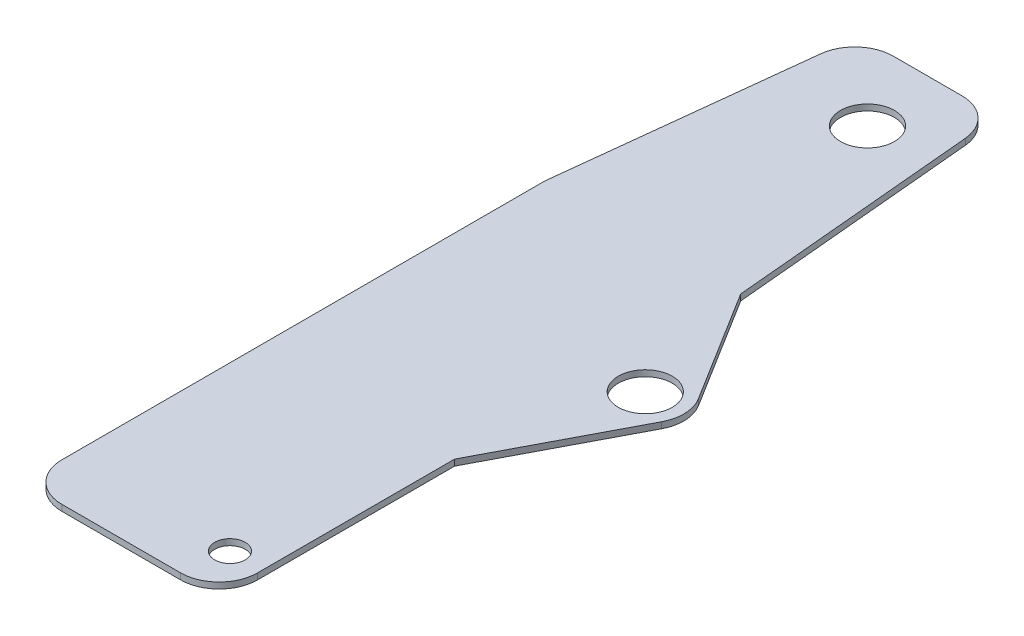
from build123d import *

# Parameters (mm, degrees)
SKETCH1_R           = 3.960069723
SKETCH1_R_2         = 7
BOSS_EXTRUDE1_DEPTH = 1.5875
SKETCH4_W           = 66.272407177
SKETCH4_H           = 27.800260981
CUT_EXTRUDE2_DEPTH  = 20
FILLET3_R           = 10
FILLET4_R           = 10
BOSS_EXTRUDE3_START = -1.5875
BOSS_EXTRUDE3_DEPTH = 1.5875
SKETCH7_R           = 7
CUT_EXTRUDE3_DEPTH  = 1.5875


with BuildPart() as part:
    # Sketch1 → Boss-Extrude1 (new body)
    with BuildSketch(Plane(origin=(0, 0, 0), x_dir=(1, 0, 0), z_dir=(0, 1, 0))):
        with BuildLine():
            Line((42.32729629, 228.6), (10.454309325, 228.6))
            Line((10.454309325, 228.6), (0, 135.362739137))
            Line((0, 135.362739137), (0, 0))
            Line((0, 0), (24.327009544, 0))
            Line((24.327009544, 0), (50.8, 0))
            Line((50.8, 0), (50.8, 64.87909603))
            Line((50.8, 64.87909603), (50.8, 87.423477361))
            Line((50.8, 87.423477361), (50.8, 98.200996728))
            ThreePointArc((50.8, 98.200996728), (50.4, 101.000996728), (50.8, 103.800996728))
            Line((50.8, 103.800996728), (50.8, 104.488200565))
            Line((50.8, 104.488200565), (50.8, 120.619222808))
            Line((50.8, 120.619222808), (50.8, 135.362739137))
            Line((50.8, 135.362739137), (42.32729629, 228.6))
        make_face()
        with Locations((42.32729629, 11.29561028)):
            Circle(SKETCH1_R, mode=Mode.SUBTRACT)
        with Locations((29.504213454, 189.557234372)):
            Circle(SKETCH1_R_2, mode=Mode.SUBTRACT)
    extrude(amount=BOSS_EXTRUDE1_DEPTH)

    # Sketch4 → Cut-Extrude2 (cut)
    with BuildSketch(Plane(origin=(0, 0, -228.6), x_dir=(-1, 0, 0), z_dir=(0, 0, -1))):
        with Locations((-28.174690156, -1.980940155)):
            Rectangle(SKETCH4_W, SKETCH4_H)
    extrude(amount=-CUT_EXTRUDE2_DEPTH, mode=Mode.SUBTRACT)

    # Fillet3
    fillet3_edges = [part.edges().sort_by_distance(p)[0] for p in [
        (44.144746445, 0.79375, -208.6),
    ]]
    fillet(fillet3_edges, radius=FILLET3_R)

    # Fillet4
    fillet4_edges = [part.edges().sort_by_distance(p)[0] for p in [
        (50.8, 0.79375, 0),
        (0, 0.79375, 0),
        (8.211791854, 0.79375, -208.6),
    ]]
    fillet(fillet4_edges, radius=FILLET4_R)

    # Sketch6 → Boss-Extrude3 (add)
    with BuildSketch(Plane(origin=(0, 1.5875, 0), x_dir=(1, 0, 0), z_dir=(0, 1, 0)).offset(BOSS_EXTRUDE3_START)):
        with BuildLine():
            Line((50.8, 135.362739137), (50.8, 103.800996728))
            ThreePointArc((50.8, 103.800996728), (50.4, 101.000996728), (50.8, 98.200996728))
            Line((50.8, 98.200996728), (50.8, 61.124243317))
            Line((50.8, 61.124243317), (69.258211507, 96.360728536))
            ThreePointArc((69.258211507, 96.360728536), (70.393157133, 101.370875786), (68.890940865, 106.283413148))
            Line((68.890940865, 106.283413148), (50.8, 135.362739137))
        make_face()
    extrude(amount=BOSS_EXTRUDE3_DEPTH)

    # Sketch7 → Cut-Extrude3 (cut)
    with BuildSketch(Plane(origin=(0, 1.5875, 0), x_dir=(1, 0, 0), z_dir=(0, 1, 0))):
        with Locations((60.4, 101.000996728)):
            Circle(SKETCH7_R)
    extrude(amount=-CUT_EXTRUDE3_DEPTH, mode=Mode.SUBTRACT)


solid = part.part
